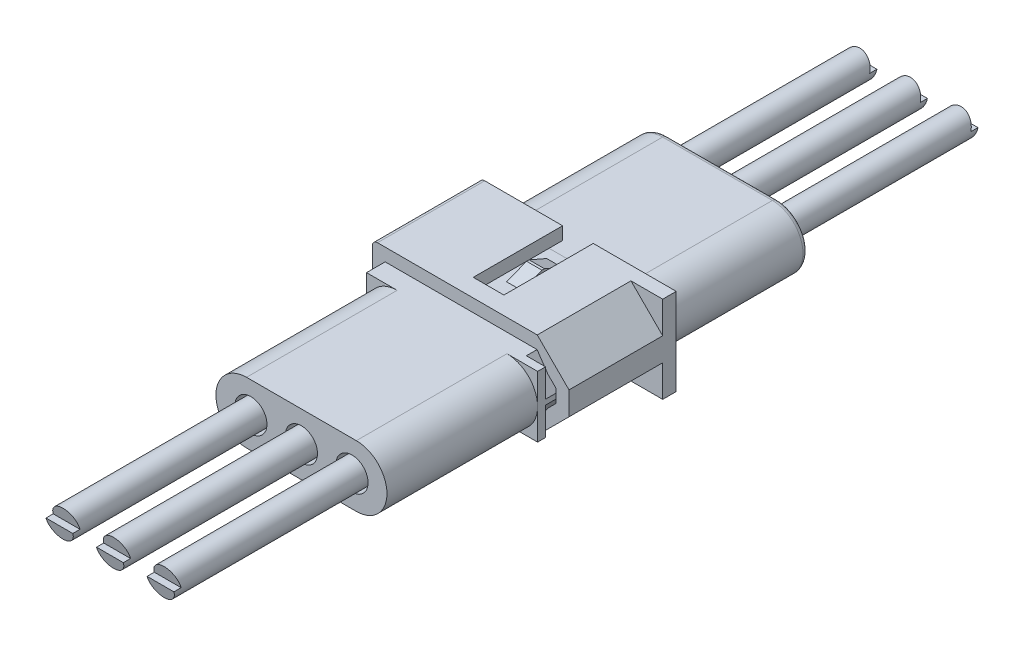
from build123d import *

# Parameters (mm, degrees)
BOSS_EXTRUDE1_DEPTH           = 10.668
SKETCH2_W                     = 17.018
SKETCH2_H                     = 6.096
SKETCH2_R                     = 1.27
BOSS_EXTRUDE2_DEPTH           = 15.7353
BOSS_EXTRUDE3_DEPTH           = 1.3462
FILLET1_RADIUS                = 3.048
FILLET1_LENGTH                = 14.3891
FILLET2_RADIUS                = 3.048
FILLET2_LENGTH                = 14.3891
FILLET3_R                     = 0.508
SKETCH4_R                     = 1.397
CUT_EXTRUDE1_DEPTH            = 0.635
CUT_EXTRUDE2_START            = -0.635
SKETCH5_R                     = 1.397
CUT_EXTRUDE2_DEPTH            = 0.635
SKETCH6_W                     = 3.048
SKETCH6_H                     = 1.27
CUT_EXTRUDE3_DEPTH            = 8.89
SKETCH7_W                     = 17.018
SKETCH7_H                     = 6.096
SKETCH7_R                     = 1.525
BOSS_EXTRUDE4_DEPTH           = 26.162
CUT_EXTRUDE4_DEPTH            = 10.3886
SKETCH9_OUTSIDE_W             = 30.966
SKETCH9_OUTSIDE_H             = 20.044
CUT_EXTRUDE5_DEPTH            = 14.986
SKETCH10_R                    = 1.6
CUT_EXTRUDE6_DEPTH            = 3
SKETCH11_R                    = 1.905
CUT_EXTRUDE7_DEPTH            = 1.27
BOSS_EXTRUDE5_START           = -7.747
BOSS_EXTRUDE5_DEPTH           = 1.524
SKETCH14_R                    = 1.3335
BOSS_EXTRUDE6_DEPTH           = 21.0693
SKETCH16_R                    = 1.3335
BOSS_EXTRUDE7_DEPTH           = 21.1074
BODY_MOVE_COPY1_START         = 8.0518
BODY_MOVE_COPY1_OUTLINE_R     = 1.3335
BODY_MOVE_COPY1_DEPTH         = 27.8384
BODY_MOVE_COPY1_START_2       = -7.1882
BODY_MOVE_COPY1_2_OUTLINE_R   = 1.4859
BODY_MOVE_COPY1_2_OUTLINE_R_2 = 1.1811
BODY_MOVE_COPY1_2_DEPTH       = 21.971
BODY_MOVE_COPY2_START         = 8.0518
BODY_MOVE_COPY2_OUTLINE_R     = 1.3335
BODY_MOVE_COPY2_DEPTH         = 27.8384
BODY_MOVE_COPY2_START_2       = -7.1882
BODY_MOVE_COPY2_2_OUTLINE_R   = 1.4859
BODY_MOVE_COPY2_2_OUTLINE_R_2 = 1.1811
BODY_MOVE_COPY2_2_DEPTH       = 21.971
CUT_EXTRUDE8_DEPTH            = 46.384030621
CUT_EXTRUDE8_DEPTH_BACK       = 46.384030621


# Read off the part's stored shape, not the designer's step: Body-Move/Copy1, Body-Move/Copy2
with BuildPart() as part:
    # Sketch1 → Boss-Extrude1 (new body)
    with BuildSketch(Plane.XY):
        with BuildLine():
            Line((6.622051224, 4.318), (-9.271, 4.318))
            ThreePointArc((-9.271, 4.318), (-9.630210245, 4.169210245), (-9.779, 3.81))
            Line((-9.779, 3.81), (-9.779, -3.81))
            ThreePointArc((-9.779, -3.81), (-9.630210245, -4.169210245), (-9.271, -4.318))
            Line((-9.271, -4.318), (6.622051224, -4.318))
            Line((6.622051224, -4.318), (9.779, -1.161051224))
            Line((9.779, -1.161051224), (9.779, 1.161051224))
            Line((9.779, 1.161051224), (6.622051224, 4.318))
        make_face()
        Polygon((8.509, -0.635), (8.509, 0.635), (6.096, 3.048), (-8.509, 3.048), (-8.509, -3.048), (6.096, -3.048), align=None, mode=Mode.SUBTRACT)
    extrude(amount=-BOSS_EXTRUDE1_DEPTH)

    # Sketch2 → Boss-Extrude2 (add)
    with BuildSketch(Plane.XY.offset(-25.0571)):
        Rectangle(SKETCH2_W, SKETCH2_H)
        Circle(SKETCH2_R, mode=Mode.SUBTRACT)
        with Locations((5.0292, 0)):
            Circle(SKETCH2_R, mode=Mode.SUBTRACT)
        with Locations((-5.0292, 0)):
            Circle(SKETCH2_R, mode=Mode.SUBTRACT)
    extrude(amount=BOSS_EXTRUDE2_DEPTH)

    # Sketch3 → Boss-Extrude3 (add)
    with BuildSketch(Plane(origin=(0, 0, -10.668), x_dir=(-1, 0, 0), z_dir=(0, 0, -1))):
        Polygon((-6.622051224, 4.318), (-9.779, 1.161051224), (-9.779, 4.318), align=None)
        Polygon((-9.779, -1.161051224), (-6.622051224, -4.318), (-9.779, -4.318), align=None)
    extrude(amount=-BOSS_EXTRUDE3_DEPTH)

    # Fillet1: full round fillet: the end face becomes a half cylinder, R = half its width
    fillet1_face = Plane((8.509, 0, -17.86255), x_dir=(0, 0, -1), z_dir=(1, 0, 0))  # on the end face: x along it, z out of the body
    fillet1_slab = fillet1_face.offset(-FILLET1_RADIUS / 2) * Box(FILLET1_LENGTH, 2 * FILLET1_RADIUS, FILLET1_RADIUS, mode=Mode.PRIVATE)  # the body's end, R deep
    fillet1_round = Plane((5.461, 0, -17.86255), x_dir=(1, 0, 0), z_dir=(0, 0, -1)) * Cylinder(FILLET1_RADIUS, FILLET1_LENGTH, mode=Mode.PRIVATE)  # its axis R under the face
    add(fillet1_slab - fillet1_round, mode=Mode.SUBTRACT)

    # Fillet2: full round fillet: the end face becomes a half cylinder, R = half its width
    fillet2_face = Plane((-8.509, 0, -17.86255), x_dir=(0, 0, 1), z_dir=(-1, 0, 0))  # on the end face: x along it, z out of the body
    fillet2_slab = fillet2_face.offset(-FILLET2_RADIUS / 2) * Box(FILLET2_LENGTH, 2 * FILLET2_RADIUS, FILLET2_RADIUS, mode=Mode.PRIVATE)  # the body's end, R deep
    fillet2_round = Plane((-5.461, 0, -17.86255), x_dir=(-1, 0, 0), z_dir=(0, 0, 1)) * Cylinder(FILLET2_RADIUS, FILLET2_LENGTH, mode=Mode.PRIVATE)  # its axis R under the face
    add(fillet2_slab - fillet2_round, mode=Mode.SUBTRACT)

    # Fillet3
    fillet3_edges = [part.edges().sort_by_distance(p)[0] for p in [
        (0, 3.048, -25.0571),
        (8.509, 0, -25.0571),
        (0, -3.048, -25.0571),
        (-8.509, 0, -25.0571),
    ]]
    fillet(fillet3_edges, radius=FILLET3_R)

    # Sketch4 → Cut-Extrude1 (cut)
    with BuildSketch(Plane(origin=(0, 0, -25.0571), x_dir=(-1, 0, 0), z_dir=(0, 0, -1))):
        with Locations((-5.0292, 0)):
            Circle(SKETCH4_R)
        Circle(SKETCH4_R)
        with Locations((5.0292, 0)):
            Circle(SKETCH4_R)
    extrude(amount=-CUT_EXTRUDE1_DEPTH, mode=Mode.SUBTRACT)

    # Sketch5 → Cut-Extrude2 (cut)
    with BuildSketch(Plane.XY.offset(-9.3218).offset(CUT_EXTRUDE2_START)):
        with Locations(Location((-5.0292, 0, 0), (0, 0, 180))):
            Circle(SKETCH5_R)
        with Locations(Location((0, 0, 0), (0, 0, 180))):
            Circle(SKETCH5_R)
        with Locations(Location((5.0292, 0, 0), (0, 0, 180))):
            Circle(SKETCH5_R)
    extrude(amount=CUT_EXTRUDE2_DEPTH, mode=Mode.SUBTRACT)

    # Sketch6 → Cut-Extrude3 (cut)
    with BuildSketch(Plane(origin=(0, 0, -10.668), x_dir=(-1, 0, 0), z_dir=(0, 0, -1))):
        with Locations((0, 3.683)):
            Rectangle(SKETCH6_W, SKETCH6_H)
        with Locations((0, -3.683)):
            Rectangle(SKETCH6_W, SKETCH6_H)
    extrude(amount=-CUT_EXTRUDE3_DEPTH, mode=Mode.SUBTRACT)


with BuildPart() as body_2:
    # Sketch7 → Boss-Extrude4 (new body)
    with BuildSketch(Plane.XY.offset(-9.3218)):
        Rectangle(SKETCH7_W, SKETCH7_H)
        Circle(SKETCH7_R, mode=Mode.SUBTRACT)
        with Locations((5.0292, 0)):
            Circle(SKETCH7_R, mode=Mode.SUBTRACT)
        with Locations((-5.0292, 0)):
            Circle(SKETCH7_R, mode=Mode.SUBTRACT)
    extrude(amount=BOSS_EXTRUDE4_DEPTH)

    # Sketch8 → Cut-Extrude4 (cut)
    with BuildSketch(Plane(origin=(0, 0, -9.3218), x_dir=(-1, 0, 0), z_dir=(0, 0, -1))):
        Polygon((-8.509, 3.048), (-6.604, 3.048), (-8.509, 0.254), align=None)
        Polygon((-8.509, -3.048), (-8.509, -0.254), (-6.604, -3.048), align=None)
    extrude(amount=-CUT_EXTRUDE4_DEPTH, mode=Mode.SUBTRACT)

    # Sketch9 outside → Cut-Extrude5 (cut)
    with BuildSketch(Plane.XY.offset(16.8402)):
        Rectangle(SKETCH9_OUTSIDE_W, SKETCH9_OUTSIDE_H)
        with BuildLine():
            Line((5.461, 3.048), (-5.461, 3.048))
            ThreePointArc((-5.461, 3.048), (-8.509, 0), (-5.461, -3.048))
            Line((-5.461, -3.048), (5.461, -3.048))
            ThreePointArc((5.461, -3.048), (8.509, 0), (5.461, 3.048))
        make_face(mode=Mode.SUBTRACT)
    extrude(amount=-CUT_EXTRUDE5_DEPTH, mode=Mode.SUBTRACT)

    # Sketch10 → Cut-Extrude6 (cut)
    with BuildSketch(Plane.XY.offset(16.8402)):
        Circle(SKETCH10_R)
        with Locations((5.0292, 0)):
            Circle(SKETCH10_R)
        with Locations((-5.0292, 0)):
            Circle(SKETCH10_R)
    extrude(amount=-CUT_EXTRUDE6_DEPTH, mode=Mode.SUBTRACT)

    # Sketch11 → Cut-Extrude7 (cut)
    with BuildSketch(Plane(origin=(0, 0, -9.3218), x_dir=(-1, 0, 0), z_dir=(0, 0, -1))):
        with Locations((-5.0292, 0)):
            Circle(SKETCH11_R)
        Circle(SKETCH11_R)
        with Locations((5.0292, 0)):
            Circle(SKETCH11_R)
    extrude(amount=-CUT_EXTRUDE7_DEPTH, mode=Mode.SUBTRACT)

    # Sketch12 → Boss-Extrude5 (add)
    with BuildSketch(Plane.ZY.offset(8.509).offset(BOSS_EXTRUDE5_START)):
        Polygon((-8.3218, 3.048), (-4.3218, 3.048), (-6.3218, 3.81), (-6.5718, 3.81), align=None)
        Polygon((-6.5718, -3.81), (-8.3218, -3.048), (-4.3218, -3.048), (-6.3218, -3.81), align=None)
    extrude(amount=-BOSS_EXTRUDE5_DEPTH)


with BuildPart() as body_3:
    # Sketch13 → Revolve1 (revolve)
    with BuildSketch(Plane(origin=(5.0292, 0, 0), x_dir=(0, 0, -1), z_dir=(1, 0, 0)), mode=Mode.PRIVATE) as revolve1_sk:
        with BuildLine():
            Line((1.0668, 0.0381), (1.0668, 0))
            Line((1.0668, 0), (23.0378, 0))
            Line((23.0378, 0), (23.0378, 1.1811))
            Line((23.0378, 1.1811), (2.2098, 1.1811))
            ThreePointArc((2.2098, 1.1811), (1.401576949, 0.846323051), (1.0668, 0.0381))
        make_face()
    revolve(revolve1_sk.sketch.rotate(Axis((5.0292, 0, 0), (0, 0, -1)), 90), axis=Axis((5.0292, 0, 0), (0, 0, -1)))

    # Sketch14 → Boss-Extrude6 (add)
    with BuildSketch(Plane(origin=(0, 0, -23.0378), x_dir=(-1, 0, 0), z_dir=(0, 0, -1))):
        with Locations((-5.0292, 0)):
            Circle(SKETCH14_R)
    extrude(amount=BOSS_EXTRUDE6_DEPTH)


with BuildPart() as body_4:
    # Sketch15 → Revolve2 (revolve)
    with BuildSketch(Plane(origin=(5.0292, 0, 0), x_dir=(0, 0, -1), z_dir=(1, 0, 0))):
        Polygon((-14.7828, 0), (-14.7828, 1.4859), (7.1882, 1.4859), (7.1882, 1.1811), (-8.0518, 1.1811), (-8.0518, 0), align=None)
    revolve(axis=Axis((5.0292, 0, 0), (0, 0, 1)))

    # Sketch16 → Boss-Extrude7 (add)
    with BuildSketch(Plane.XY.offset(14.7828)):
        with Locations((5.0292, 0)):
            Circle(SKETCH16_R)
    extrude(amount=BOSS_EXTRUDE7_DEPTH)


with BuildPart() as body_5:
    # Body-Move/Copy1 outline → Body-Move/Copy1 (new body)
    with BuildSketch(Plane.XY.offset(BODY_MOVE_COPY1_START)):
        Circle(BODY_MOVE_COPY1_OUTLINE_R)
    extrude(amount=BODY_MOVE_COPY1_DEPTH)

    # Body-Move_Copy1 2 outline → Body-Move_Copy1 2 (add)
    with BuildSketch(Plane.XY.offset(BODY_MOVE_COPY1_START_2)):
        Circle(BODY_MOVE_COPY1_2_OUTLINE_R)
        Circle(BODY_MOVE_COPY1_2_OUTLINE_R_2, mode=Mode.SUBTRACT)
    extrude(amount=BODY_MOVE_COPY1_2_DEPTH)


with BuildPart() as body_6:
    # Body-Move_Copy1 3 outline → Body-Move_Copy1 3 (revolve)
    with BuildSketch(Plane.XZ):
        with BuildLine():
            Line((1.3335, -44.1071), (1.3335, -23.0378))
            Line((1.3335, -23.0378), (1.1811, -23.0378))
            Line((1.1811, -23.0378), (1.1811, -2.2098))
            ThreePointArc((1.1811, -2.2098), (0.846323051, -1.401576949), (0.0381, -1.0668))
            Line((0.0381, -1.0668), (0, -1.0668))
            Line((0, -1.0668), (0, -44.1071))
            Line((0, -44.1071), (1.3335, -44.1071))
        make_face()
    revolve(axis=Axis((0, 0, 0), (0, 0, 1)))


with BuildPart() as body_7:
    # Body-Move/Copy2 outline → Body-Move/Copy2 (new body)
    with BuildSketch(Plane.XY.offset(BODY_MOVE_COPY2_START)):
        with Locations((-5.0292, 0)):
            Circle(BODY_MOVE_COPY2_OUTLINE_R)
    extrude(amount=BODY_MOVE_COPY2_DEPTH)

    # Body-Move_Copy2 2 outline → Body-Move_Copy2 2 (add)
    with BuildSketch(Plane.XY.offset(BODY_MOVE_COPY2_START_2)):
        with Locations((-5.0292, 0)):
            Circle(BODY_MOVE_COPY2_2_OUTLINE_R)
        with Locations((-5.0292, 0)):
            Circle(BODY_MOVE_COPY2_2_OUTLINE_R_2, mode=Mode.SUBTRACT)
    extrude(amount=BODY_MOVE_COPY2_2_DEPTH)


with BuildPart() as body_8:
    # Body-Move_Copy2 3 outline → Body-Move_Copy2 3 (revolve)
    with BuildSketch(Plane(origin=(-5.0292, 0, 0), x_dir=(1, 0, 0), z_dir=(0, -1, 0))):
        with BuildLine():
            Line((0.0381, -1.0668), (0, -1.0668))
            Line((0, -1.0668), (0, -44.1071))
            Line((0, -44.1071), (1.3335, -44.1071))
            Line((1.3335, -44.1071), (1.3335, -23.0378))
            Line((1.3335, -23.0378), (1.1811, -23.0378))
            Line((1.1811, -23.0378), (1.1811, -2.2098))
            ThreePointArc((1.1811, -2.2098), (0.846323051, -1.401576949), (0.0381, -1.0668))
        make_face()
    revolve(axis=Axis((-5.0292, 0, 0), (0, 0, 1)))


with BuildPart() as cut_extrude8_tool:
    # Sketch17 → Cut-Extrude8 (new, two sides: drawn at the far end of the back side and taken through both)
    with BuildSketch(Plane(origin=(0, 0, 0), x_dir=(0, 0, -1), z_dir=(1, 0, 0)).offset(-CUT_EXTRUDE8_DEPTH_BACK)):
        Polygon((-35.8902, 0), (-35.175579504, 0), (-35.532889752, 1.3335), (-36.5252, 1.3335), (-36.5252, -1.3335), (-35.532889752, -1.3335), align=None)
        Polygon((43.749789752, 1.3335), (44.7421, 1.3335), (44.7421, -1.3335), (43.749789752, -1.3335), (44.1071, 0), (43.392479504, 0), align=None)
    extrude(amount=CUT_EXTRUDE8_DEPTH + CUT_EXTRUDE8_DEPTH_BACK)


with BuildPart() as body_3_1:
    add(body_3.part)

    # Cut-Extrude8: cut by cut_extrude8_tool
    add(cut_extrude8_tool.part, mode=Mode.SUBTRACT)


with BuildPart() as body_4_1:
    add(body_4.part)

    # Cut-Extrude8: cut by cut_extrude8_tool
    add(cut_extrude8_tool.part, mode=Mode.SUBTRACT)


with BuildPart() as body_5_1:
    add(body_5.part)

    # Cut-Extrude8: cut by cut_extrude8_tool
    add(cut_extrude8_tool.part, mode=Mode.SUBTRACT)


with BuildPart() as body_6_1:
    add(body_6.part)

    # Cut-Extrude8: cut by cut_extrude8_tool
    add(cut_extrude8_tool.part, mode=Mode.SUBTRACT)


with BuildPart() as body_7_1:
    add(body_7.part)

    # Cut-Extrude8: cut by cut_extrude8_tool
    add(cut_extrude8_tool.part, mode=Mode.SUBTRACT)


with BuildPart() as body_8_1:
    add(body_8.part)

    # Cut-Extrude8: cut by cut_extrude8_tool
    add(cut_extrude8_tool.part, mode=Mode.SUBTRACT)


solid = Compound([part.part, body_2.part, body_3_1.part, body_4_1.part, body_5_1.part, body_6_1.part, body_7_1.part, body_8_1.part])
